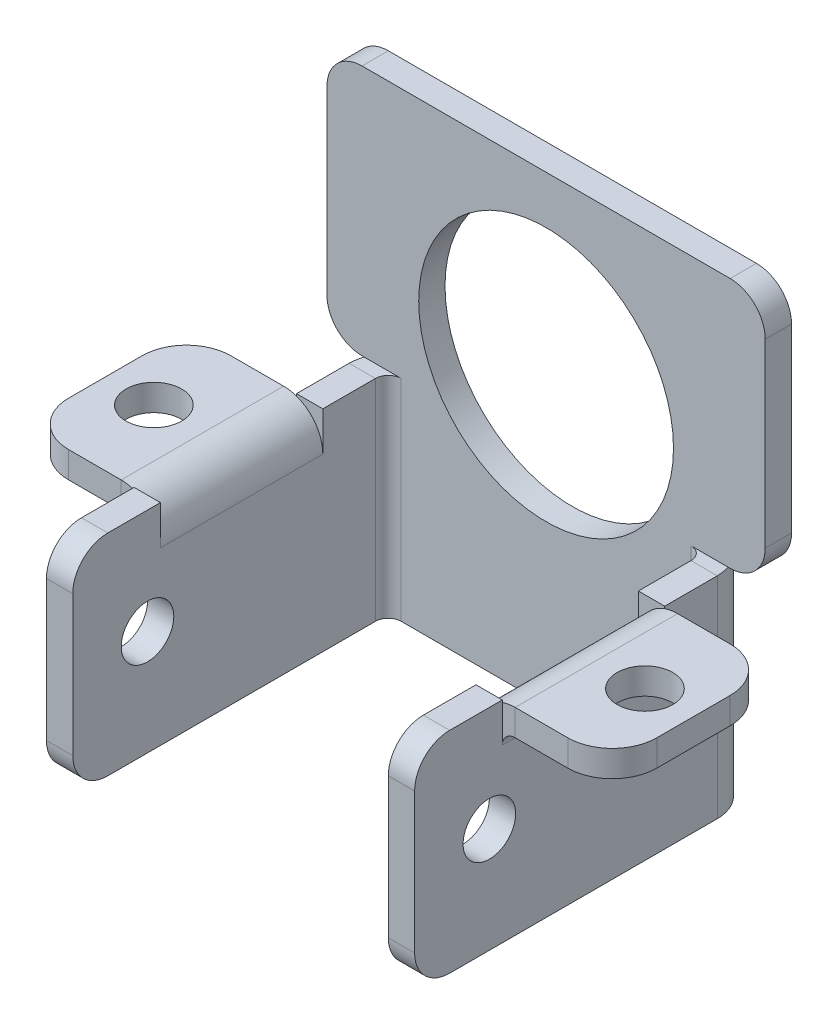
from build123d import *

# Parameters (mm, degrees)
SKETCH1_R                      = 7.266716582
BASE_FLANGE1_DEPTH             = 1.5
EDGE_FLANGE1_STRIP_W           = 7.4732
EDGE_FLANGE1_STRIP_H           = 1.5
EDGE_FLANGE1_STRIP_CUT_DEPTH   = 12
EDGE_FLANGE1_STRIP_2_W         = 7.4732
EDGE_FLANGE1_STRIP_2_H         = 1.5
EDGE_FLANGE1_STRIP_CUT_2_DEPTH = 12
EDGE_FLANGE1_DEPTH             = 12
EDGE_FLANGE1_BEND_DEPTH        = 12
SKETCH9_R                      = 1.5
CUT_EXTRUDE1_DEPTH             = 35.286317994
FILLET1_R                      = 2
EDGE_FLANGE3_STRIP_W           = 7.4732
EDGE_FLANGE3_STRIP_H           = 1.5
EDGE_FLANGE3_STRIP_CUT_DEPTH   = 9.2634
EDGE_FLANGE3_DEPTH             = 9.2634
FILLET2_R                      = 2.54
FILLET2_OF_MIRROR1_R           = 2.54
SKETCH20_R                     = 1.5875
CUT_EXTRUDE3_DEPTH             = 2.54


# Sheet-metal steps are written as plain solids
with BuildPart() as part:
    # Sketch1 → Base-Flange1 (new body)
    with BuildSketch(Plane.XY):
        Polygon((-9, -16.31875), (9, -16.31875), (9, -4.31875), (12.5, -4.31875), (12.5, 10), (-12.5, 10), (-12.5, -4.31875), (-9, -4.31875), align=None)
        Circle(SKETCH1_R, mode=Mode.SUBTRACT)
    extrude(amount=BASE_FLANGE1_DEPTH)

    # Edge-Flange1 strip (across the edge) → Edge-Flange1 strip cut (cut)
    with BuildSketch(Plane(origin=(-9, -4.31875, 1.5), x_dir=(1, 0, 0), z_dir=(0, -1, 0))):
        with Locations((-3, -0.75)):
            Rectangle(EDGE_FLANGE1_STRIP_W, EDGE_FLANGE1_STRIP_H)
    extrude(amount=EDGE_FLANGE1_STRIP_CUT_DEPTH, mode=Mode.SUBTRACT)

    # Edge-Flange1 strip 2 (across the edge) → Edge-Flange1 strip cut 2 (cut)
    with BuildSketch(Plane(origin=(9, -16.31875, 1.5), x_dir=(-1, 0, 0), z_dir=(0, 1, 0))):
        with Locations((-3, -0.75)):
            Rectangle(EDGE_FLANGE1_STRIP_2_W, EDGE_FLANGE1_STRIP_2_H)
    extrude(amount=EDGE_FLANGE1_STRIP_CUT_2_DEPTH, mode=Mode.SUBTRACT)

    # Edge-Flange1 section (across the edge) → Edge-Flange1 (add)
    with BuildSketch(Plane(origin=(-9, -4.31875, 1.5), x_dir=(1, 0, 0), z_dir=(0, -1, 0))):
        with BuildLine():
            Line((-1.5, 0.7366), (-1.5, 18))
            Line((-1.5, 18), (0, 18))
            Line((0, 18), (0, 0.7366))
            ThreePointArc((0, 0.7366), (0.215745145, 0.215745145), (0.7366, 0))
            Line((0.7366, 0), (0.7366, -1.5))
            ThreePointArc((0.7366, -1.5), (-0.844915027, -0.844915027), (-1.5, 0.7366))
        make_face()
    extrude(amount=EDGE_FLANGE1_DEPTH)

    # Edge-Flange1 section 2 (across the edge) → Edge-Flange1 bend (add)
    with BuildSketch(Plane(origin=(9, -16.31875, 1.5), x_dir=(-1, 0, 0), z_dir=(0, 1, 0))):
        with BuildLine():
            Line((-1.5, 0.7366), (-1.5, 18))
            Line((-1.5, 18), (0, 18))
            Line((0, 18), (0, 0.7366))
            ThreePointArc((0, 0.7366), (0.215745145, 0.215745145), (0.7366, 0))
            Line((0.7366, 0), (0.7366, -1.5))
            ThreePointArc((0.7366, -1.5), (-0.844915027, -0.844915027), (-1.5, 0.7366))
        make_face()
    extrude(amount=EDGE_FLANGE1_BEND_DEPTH)

    # Sketch9 → Cut-Extrude1 (cut, through all)
    with BuildSketch(Plane(origin=(10.5, 0, 0), x_dir=(0, 0, -1), z_dir=(1, 0, 0))):
        with Locations((-15.2366, -10.31875)):
            Circle(SKETCH9_R)
    extrude(amount=-CUT_EXTRUDE1_DEPTH, mode=Mode.SUBTRACT)

    # Fillet1
    fillet1_edges = [part.edges().sort_by_distance(p)[0] for p in [
        (-12.5, -4.31875, 0.75),
        (-12.5, 10, 0.75),
        (12.5, 10, 0.75),
        (12.5, -4.31875, 0.75),
        (-9.75, -4.31875, 19.5),
        (-9.75, -16.31875, 19.5),
        (9.75, -16.31875, 19.5),
        (9.75, -4.31875, 19.5),
    ]]
    fillet(fillet1_edges, radius=FILLET1_R)

    # Edge-Flange3 strip (across the edge) → Edge-Flange3 strip cut (cut)
    with BuildSketch(Plane(origin=(10.5, -4.31875, 5.2366), x_dir=(0, -1, 0), z_dir=(0, 0, 1))):
        with Locations((-1.5, -0.75)):
            Rectangle(EDGE_FLANGE3_STRIP_W, EDGE_FLANGE3_STRIP_H)
    edge_flange3_strip_cut = extrude(amount=EDGE_FLANGE3_STRIP_CUT_DEPTH, mode=Mode.SUBTRACT)

    # Edge-Flange3 section (across the edge) → Edge-Flange3 (add)
    with BuildSketch(Plane(origin=(10.5, -4.31875, 5.2366), x_dir=(0, -1, 0), z_dir=(0, 0, 1))):
        with BuildLine():
            Line((0, 0.7366), (0, 6.2766))
            Line((0, 6.2766), (1.5, 6.2766))
            Line((1.5, 6.2766), (1.5, 0.7366))
            ThreePointArc((1.5, 0.7366), (1.715745145, 0.215745145), (2.2366, 0))
            Line((2.2366, 0), (2.2366, -1.5))
            ThreePointArc((2.2366, -1.5), (0.655084973, -0.844915027), (0, 0.7366))
        make_face()
    edge_flange3 = extrude(amount=EDGE_FLANGE3_DEPTH)

    # Fillet2
    fillet2_edges = [part.edges().sort_by_distance(p)[0] for p in [
        (16.7766, -5.06875, 5.2366),
        (16.7766, -5.06875, 14.5),
    ]]
    fillet(fillet2_edges, radius=FILLET2_R)

    # Mirror1: Edge-Flange3 strip cut, Edge-Flange3 across plane
    add(edge_flange3_strip_cut.mirror(Plane(origin=(0, 0, 0), x_dir=(0, 0, 1), z_dir=(1, 0, 0))), mode=Mode.SUBTRACT)
    add(edge_flange3.mirror(Plane(origin=(0, 0, 0), x_dir=(0, 0, 1), z_dir=(1, 0, 0))))

    # Fillet2 of Mirror1
    fillet2_of_mirror1_edges = [part.edges().sort_by_distance(p)[0] for p in [
        (-16.7766, -5.06875, 5.2366),
        (-16.7766, -5.06875, 14.5),
    ]]
    fillet(fillet2_of_mirror1_edges, radius=FILLET2_OF_MIRROR1_R)

    # Sketch20 → Cut-Extrude3 (cut)
    with BuildSketch(Plane(origin=(0, -4.31875, 0), x_dir=(1, 0, 0), z_dir=(0, 1, 0))):
        with Locations(Location((14.0066, -9.8683, 0), (0, 0, 180))):
            Circle(SKETCH20_R)
        with Locations(Location((-14.0066, -9.8683, 0), (0, 0, 180))):
            Circle(SKETCH20_R)
    extrude(amount=-CUT_EXTRUDE3_DEPTH, mode=Mode.SUBTRACT)


solid = part.part
